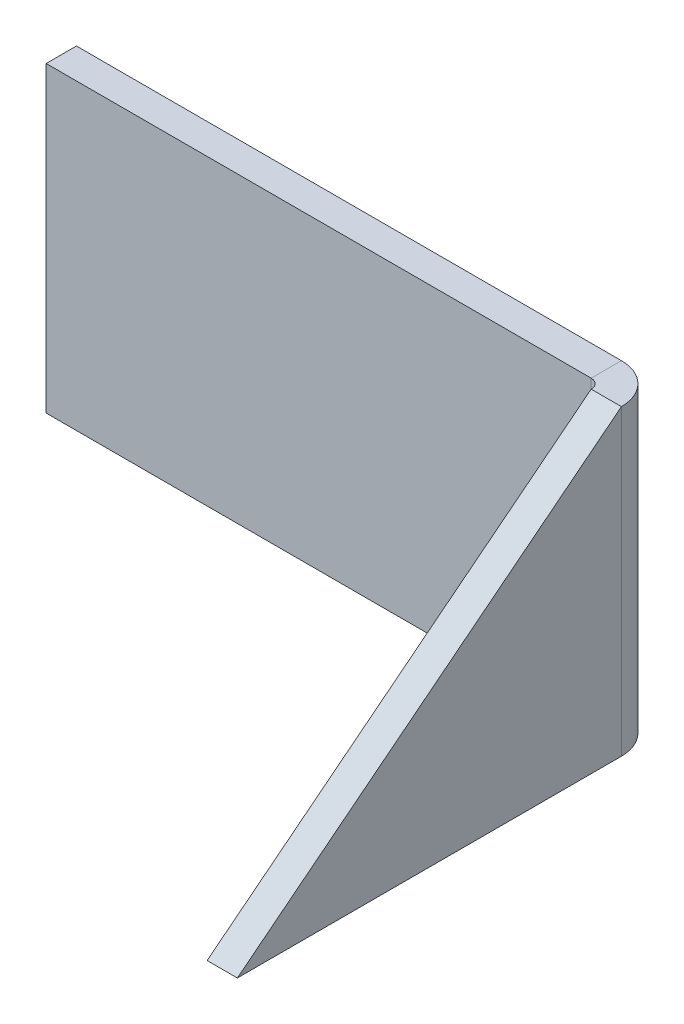
from build123d import *

# Parameters (mm, degrees)
SKETCH2_W          = 57.15
SKETCH2_H          = 31.75
BASE_FLANGE1_DEPTH = 3.175
EDGE_FLANGE1_DEPTH = 31.75
CUT_EXTRUDE1_DEPTH = 3.175


# Sheet-metal steps are written as plain solids
with BuildPart() as part:
    # Sketch2 → Base-Flange1 (new body)
    with BuildSketch(Plane.XY):
        Rectangle(SKETCH2_W, SKETCH2_H)
    extrude(amount=BASE_FLANGE1_DEPTH)

    # Edge-Flange1 section (across the edge) → Edge-Flange1 (add)
    with BuildSketch(Plane(origin=(29.575, -15.875, 3.175), x_dir=(-1, 0, 0), z_dir=(0, 1, 0))):
        with BuildLine():
            Line((-3.175, 1), (-3.175, 41.275))
            Line((-3.175, 41.275), (0, 41.275))
            Line((0, 41.275), (0, 1))
            ThreePointArc((0, 1), (0.292893219, 0.292893219), (1, 0))
            Line((1, 0), (1, -3.175))
            ThreePointArc((1, -3.175), (-1.952170811, -1.952170811), (-3.175, 1))
        make_face()
    extrude(amount=EDGE_FLANGE1_DEPTH)

    # Sketch10 → Cut-Extrude1 (cut)
    with BuildSketch(Plane(origin=(32.75, 0, 0), x_dir=(0, 0, -1), z_dir=(1, 0, 0))):
        Polygon((-4.175, 15.875), (-44.45, -15.875), (-44.45, 15.875), align=None)
    extrude(amount=-CUT_EXTRUDE1_DEPTH, mode=Mode.SUBTRACT)


solid = part.part
